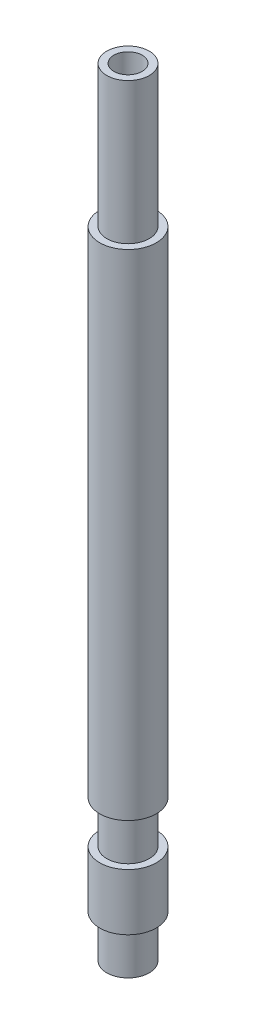
from build123d import *

# Parameters (mm, degrees)
SKETCH_1_R      = 2
SKETCH_1_R_2    = 1
EXTRUDE_1_DEPTH = 55
SKETCH_2_W      = 0.5
SKETCH_2_H      = 3
SKETCH_2_H_2    = 10


with BuildPart() as part:
    # Эскиз1 → Бобышка-Вытянуть1 (new body)
    with BuildSketch(Plane(origin=(0, 0, 0), x_dir=(1, 0, 0), z_dir=(0, 1, 0))):
        Circle(SKETCH_1_R)
        Circle(SKETCH_1_R_2, mode=Mode.SUBTRACT)
    extrude(amount=EXTRUDE_1_DEPTH)

    # Эскиз2 → Вырез-Повернуть1 (revolve, cut)
    with BuildSketch(Plane.XY):
        with Locations((1.75, 1.5)):
            Rectangle(SKETCH_2_W, SKETCH_2_H)
        with Locations((1.75, 8.5)):
            Rectangle(SKETCH_2_W, SKETCH_2_H)
        with Locations((1.75, 50)):
            Rectangle(SKETCH_2_W, SKETCH_2_H_2)
    revolve(axis=Axis((0, 0, 0), (0, 1, 0)), mode=Mode.SUBTRACT)


solid = part.part
